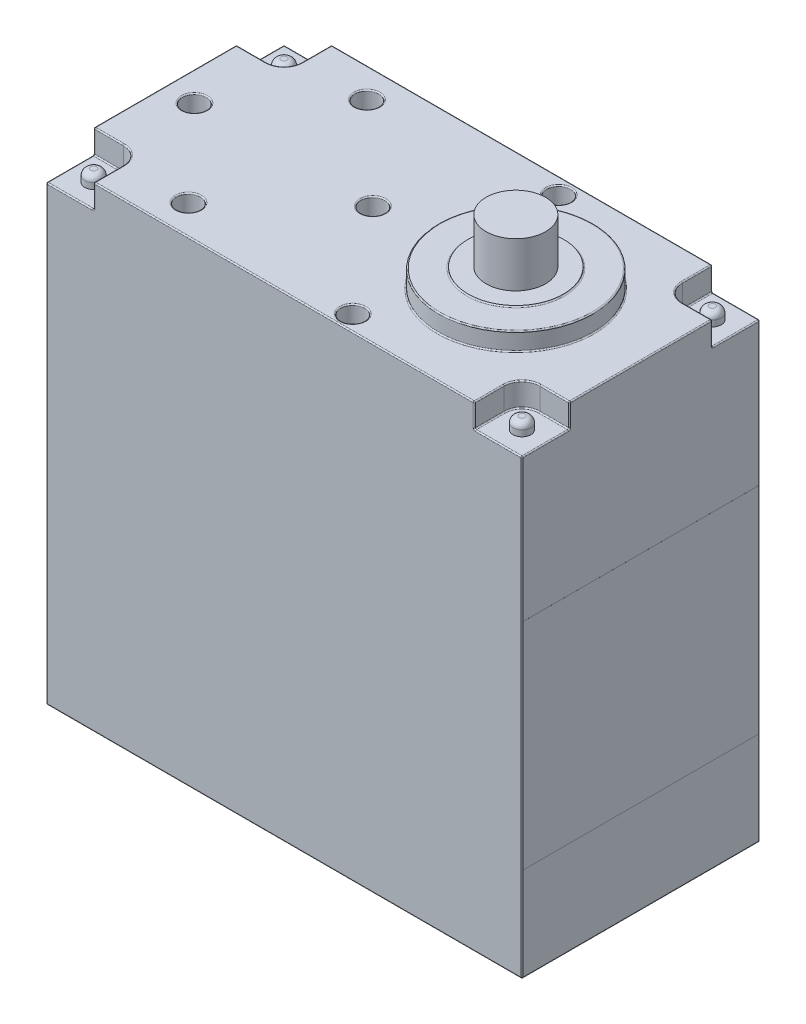
from build123d import *

# Parameters (mm, degrees)
IZIM1_W                      = 40
IZIM1_H                      = 40
Y_KSEKLIK_EKSTR_ZYON1_DEPTH  = 20
IZIM2_R                      = 1
KES_EKSTR_ZYON1_DEPTH        = 2
IZIM3_R                      = 6.5
Y_KSEKLIK_EKSTR_ZYON2_DEPTH  = 1.5
IZIM4_R                      = 4
Y_KSEKLIK_EKSTR_ZYON3_DEPTH  = 0.1
IZIM5_R                      = 2.5
Y_KSEKLIK_EKSTR_ZYON4_DEPTH  = 3.8
RADYUS2_R                    = 0.1
RADYUS3_R                    = 0.1
RADYUS4_R                    = 0.1
IZIM7_R                      = 0.75
Y_KSEKLIK_EKSTR_ZYON5_DEPTH  = 1
RADYUS5_R                    = 0.5
L_O_ALTMA1_COUNT             = 2
L_O_ALTMA1_PITCH             = 36
L_O_ALTMA1_COUNT_DIR2        = 2
L_O_ALTMA1_PITCH_DIR2        = 16
RADYUS5_OF_L_O_ALTMA1_R      = 0.5
IZIM8_R                      = 1
KES_EKSTR_ZYON2_DEPTH        = 2
IZIM9_R                      = 6.5
Y_KSEKLIK_EKSTR_ZYON6_DEPTH  = 1.5
IZIM10_R                     = 4
Y_KSEKLIK_EKSTR_ZYON7_DEPTH  = 0.1
IZIM11_R                     = 4
Y_KSEKLIK_EKSTR_ZYON8_DEPTH  = 4.1
IZIM13_W                     = 39.8
IZIM13_H                     = 18.09
Y_KSEKLIK_EKSTR_ZYON10_DEPTH = 0.001
IZIM16_W                     = 19.8
IZIM16_H                     = 18.09
Y_KSEKLIK_EKSTR_ZYON11_DEPTH = 0.001
IZIM17_W                     = 19.8
IZIM17_H                     = 18.09
Y_KSEKLIK_EKSTR_ZYON12_DEPTH = 0.001


with BuildPart() as part:
    # Çizim1 → Yükseklik-Ekstrüzyon1 (new body)
    with BuildSketch(Plane.XY):
        with Locations((20, 20)):
            Rectangle(IZIM1_W, IZIM1_H)
    extrude(amount=Y_KSEKLIK_EKSTR_ZYON1_DEPTH)

    # Çizim2 → Kes-Ekstrüzyon1 (cut)
    with BuildSketch(Plane(origin=(0, 40, 0), x_dir=(1, 0, 0), z_dir=(0, 1, 0))):
        with Locations(Location((2.462980944, -10, 0), (0, 0, 270))):
            Circle(IZIM2_R)
        with Locations(Location((9.462980944, -17.5, 0), (0, 0, 270))):
            Circle(IZIM2_R)
        with Locations(Location((9.462980944, -2.5, 0), (0, 0, 270))):
            Circle(IZIM2_R)
        with Locations(Location((24.462980944, -1.379697159, 0), (0, 0, 270))):
            Circle(IZIM2_R)
        with Locations(Location((24.462980944, -18.692209354, 0), (0, 0, 270))):
            Circle(IZIM2_R)
        with Locations(Location((17.462980944, -10, 0), (0, 0, 270))):
            Circle(IZIM2_R)
        with BuildLine():
            Line((0, 0), (4, 0))
            Line((4, 0), (4, -2.5))
            ThreePointArc((4, -2.5), (3.560660172, -3.560660172), (2.5, -4))
            Line((2.5, -4), (0, -4))
            Line((0, -4), (0, 0))
        make_face()
        with BuildLine():
            Line((0, -20), (4, -20))
            Line((4, -20), (4, -17.5))
            ThreePointArc((4, -17.5), (3.560660172, -16.439339828), (2.5, -16))
            Line((2.5, -16), (0, -16))
            Line((0, -16), (0, -20))
        make_face()
        with BuildLine():
            Line((40, 0), (36, 0))
            Line((36, 0), (36, -2.5))
            ThreePointArc((36, -2.5), (36.439339828, -3.560660172), (37.5, -4))
            Line((37.5, -4), (40, -4))
            Line((40, -4), (40, 0))
        make_face()
        with BuildLine():
            Line((40, -20), (36, -20))
            Line((36, -20), (36, -17.5))
            ThreePointArc((36, -17.5), (36.439339828, -16.439339828), (37.5, -16))
            Line((37.5, -16), (40, -16))
            Line((40, -16), (40, -20))
        make_face()
    extrude(amount=-KES_EKSTR_ZYON1_DEPTH, mode=Mode.SUBTRACT)

    # Çizim3 → Yükseklik-Ekstrüzyon2 (add)
    with BuildSketch(Plane(origin=(0, 40, 0), x_dir=(1, 0, 0), z_dir=(0, 1, 0))):
        with Locations(Location((29.482980944, -10, 0), (0, 0, 90))):
            Circle(IZIM3_R)
    extrude(amount=Y_KSEKLIK_EKSTR_ZYON2_DEPTH)

    # Çizim4 → Yükseklik-Ekstrüzyon3 (add)
    with BuildSketch(Plane(origin=(0, 41.5, 0), x_dir=(1, 0, 0), z_dir=(0, 1, 0))):
        with Locations(Location((29.482980944, -10, 0), (0, 0, 270))):
            Circle(IZIM4_R)
    extrude(amount=Y_KSEKLIK_EKSTR_ZYON3_DEPTH)

    # Çizim5 → Yükseklik-Ekstrüzyon4 (add)
    with BuildSketch(Plane(origin=(0, 41.6, 0), x_dir=(1, 0, 0), z_dir=(0, 1, 0))):
        with Locations(Location((29.482980944, -10, 0), (0, 0, 90))):
            Circle(IZIM5_R)
    extrude(amount=Y_KSEKLIK_EKSTR_ZYON4_DEPTH)

    # Radyus2
    radyus2_edges = [part.edges().sort_by_distance(p)[0] for p in [
        (29.482980944, 41.5, 16.5),
        (29.482980944, 41.5, 6),
        (40, 19, 20),
        (0, 19, 0),
        (20, 40, 0),
        (0, 19, 20),
        (20, 40, 20),
        (0, 40, 10),
        (40, 40, 10),
        (0, 38, 18),
        (1.25, 38, 16),
        (0, 39, 16),
        (3.560660172, 38, 16.439339828),
        (4, 38, 18.75),
        (2, 38, 20),
        (4, 39, 20),
        (4, 40, 18.75),
        (3.560660172, 40, 16.439339828),
        (1.25, 40, 16),
        (40, 38, 2),
        (38.75, 38, 4),
        (40, 39, 4),
        (36.439339828, 38, 3.560660172),
        (36, 38, 1.25),
        (38, 38, 0),
        (36, 39, 0),
        (36, 40, 1.25),
        (36.439339828, 40, 3.560660172),
        (38.75, 40, 4),
        (40, 19, 0),
        (40, 38, 18),
        (40, 39, 16),
        (38, 38, 20),
        (36, 38, 18.75),
        (36, 39, 20),
        (36.439339828, 38, 16.439339828),
        (38.75, 38, 16),
        (38.75, 40, 16),
        (20, 0, 0),
        (36.439339828, 40, 16.439339828),
        (36, 40, 18.75),
        (0, 38, 2),
        (0, 39, 4),
        (2, 38, 0),
        (4, 38, 1.25),
        (4, 39, 0),
        (3.560660172, 38, 3.560660172),
        (1.25, 38, 4),
        (1.25, 40, 4),
        (3.560660172, 40, 3.560660172),
        (4, 40, 1.25),
        (40, 0, 10),
        (0, 0, 10),
        (20, 0, 20),
    ]]
    fillet(radyus2_edges, radius=RADYUS2_R - 0.0001)  # a hair under: the kernel refuses the full size

    # Radyus3
    radyus3_edges = [part.edges().sort_by_distance(p)[0] for p in [
        (2.462980944, 40, 9),
    ]]
    fillet(radyus3_edges, radius=RADYUS3_R)

    # Radyus4
    radyus4_edges = [part.edges().sort_by_distance(p)[0] for p in [
        (29.482980944, 40, 16.5),
        (24.462980944, 40, 17.692209354),
        (17.462980944, 40, 9),
        (9.462980944, 40, 1.5),
        (9.462980944, 40, 16.5),
        (24.462980944, 40, 0.379697159),
    ]]
    fillet(radyus4_edges, radius=RADYUS4_R)

    # Çizim7 → Yükseklik-Ekstrüzyon5 (add)
    with BuildSketch(Plane(origin=(0, 38, 0), x_dir=(1, 0, 0), z_dir=(0, 1, 0))):
        with Locations(Location((2, -18, 0), (0, 0, 90))):
            Circle(IZIM7_R)
    y_kseklik_ekstr_zyon5 = extrude(amount=Y_KSEKLIK_EKSTR_ZYON5_DEPTH)

    # Radyus5
    radyus5_edges = [part.edges().sort_by_distance(p)[0] for p in [
        (2, 39, 18.75),
    ]]
    fillet(radyus5_edges, radius=RADYUS5_R)

    # LÇoğaltma1: Y_kseklik-Ekstr_zyon5 2 × 2
    with Locations(*[(i * L_O_ALTMA1_PITCH, 0, -j * L_O_ALTMA1_PITCH_DIR2) for i in range(L_O_ALTMA1_COUNT) for j in range(L_O_ALTMA1_COUNT_DIR2) if (i, j) != (0, 0)]):
        add(y_kseklik_ekstr_zyon5)

    # Radyus5 of LÇoğaltma1
    radyus5_of_l_o_altma1_edges = [part.edges().sort_by_distance(p)[0] for p in [
        (2, 39, 2.75),
        (38, 39, 18.75),
        (38, 39, 2.75),
    ]]
    fillet(radyus5_of_l_o_altma1_edges, radius=RADYUS5_OF_L_O_ALTMA1_R)

    # Çizim8 → Kes-Ekstrüzyon2 (cut)
    with BuildSketch(Plane.XZ):
        with Locations(Location((1.6, 17.5, 0), (0, 0, 270))):
            Circle(IZIM8_R)
        with Locations(Location((16.6, 17.5, 0), (0, 0, 270))):
            Circle(IZIM8_R)
        with Locations(Location((16.6, 2.5, 0), (0, 0, 270))):
            Circle(IZIM8_R)
        with Locations(Location((1.6, 2.5, 0), (0, 0, 270))):
            Circle(IZIM8_R)
        with Locations(Location((36.6, 17.5, 0), (0, 0, 270))):
            Circle(IZIM8_R)
        with Locations(Location((36.6, 2.5, 0), (0, 0, 270))):
            Circle(IZIM8_R)
    extrude(amount=-KES_EKSTR_ZYON2_DEPTH, mode=Mode.SUBTRACT)

    # Çizim9 → Yükseklik-Ekstrüzyon6 (add)
    with BuildSketch(Plane.XZ):
        with Locations(Location((29.1, 10, 0), (0, 0, 90))):
            Circle(IZIM9_R)
    extrude(amount=Y_KSEKLIK_EKSTR_ZYON6_DEPTH)

    # Çizim10 → Yükseklik-Ekstrüzyon7 (add)
    with BuildSketch(Plane.XZ.offset(1.5)):
        with Locations(Location((29.1, 10, 0), (0, 0, 270))):
            Circle(IZIM10_R)
    extrude(amount=Y_KSEKLIK_EKSTR_ZYON7_DEPTH)

    # Çizim11 → Yükseklik-Ekstrüzyon8 (add)
    with BuildSketch(Plane.XZ.offset(1.6)):
        with Locations(Location((29.1, 10, 0), (0, 0, 270))):
            Circle(IZIM11_R)
    extrude(amount=Y_KSEKLIK_EKSTR_ZYON8_DEPTH)

    # Çizim13 → Yükseklik-Ekstrüzyon10 (add)
    with BuildSketch(Plane(origin=(0, 0, 0), x_dir=(-1, 0, 0), z_dir=(0, 0, -1))):
        with Locations((-20, 16.945)):
            Rectangle(IZIM13_W, IZIM13_H)
    extrude(amount=Y_KSEKLIK_EKSTR_ZYON10_DEPTH)

    # Çizim16 → Yükseklik-Ekstrüzyon11 (add)
    with BuildSketch(Plane.ZY):
        with Locations((10, 16.945589153)):
            Rectangle(IZIM16_W, IZIM16_H)
    extrude(amount=Y_KSEKLIK_EKSTR_ZYON11_DEPTH)

    # Çizim17 → Yükseklik-Ekstrüzyon12 (add)
    with BuildSketch(Plane(origin=(40, 0, 0), x_dir=(0, 0, -1), z_dir=(1, 0, 0))):
        with Locations((-10, 16.936409482)):
            Rectangle(IZIM17_W, IZIM17_H)
    extrude(amount=Y_KSEKLIK_EKSTR_ZYON12_DEPTH)


solid = part.part
